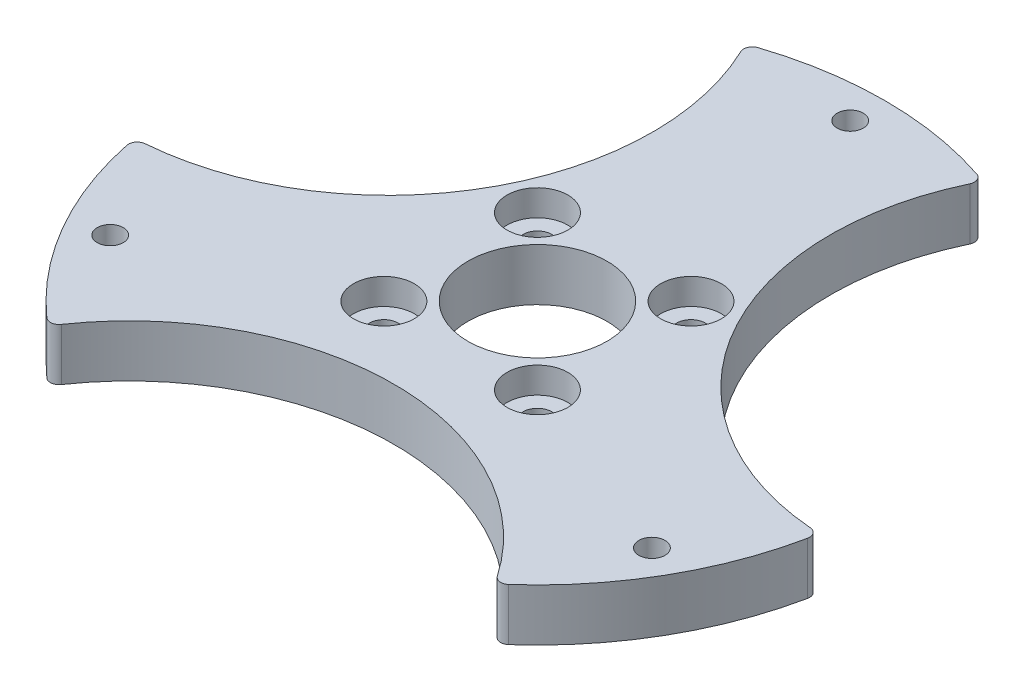
from build123d import *

# Parameters (mm, degrees)
SKETCH1_R           = 40
BOSS_EXTRUDE1_DEPTH = 6
SKETCH3_R           = 30.471270003
CUT_EXTRUDE1_DEPTH  = 57.885850613
SKETCH5_R           = 1.5
CUT_EXTRUDE2_DEPTH  = 57.885850613
CIRPATTERN1_COUNT   = 3
SKETCH6_R           = 1.65
CUT_EXTRUDE3_DEPTH  = 57.460199226
SKETCH7_R           = 8
CUT_EXTRUDE4_DEPTH  = 57.460199226
FILLET1_R           = 1
SKETCH8_R           = 3.5
CUT_EXTRUDE5_DEPTH  = 3


with BuildPart() as part:
    # Sketch1 → Boss-Extrude1 (new body)
    with BuildSketch(Plane(origin=(0, 0, 0), x_dir=(1, 0, 0), z_dir=(0, 1, 0))):
        Circle(SKETCH1_R)
    extrude(amount=BOSS_EXTRUDE1_DEPTH)

    # Sketch3 → Cut-Extrude1 (cut, through all)
    with BuildSketch(Plane(origin=(0, 6, 0), x_dir=(1, 0, 0), z_dir=(0, 1, 0))):
        with Locations((40.698571494, 23.497331208)):
            Circle(SKETCH3_R)
    cut_extrude1 = extrude(amount=-CUT_EXTRUDE1_DEPTH, mode=Mode.SUBTRACT)

    # Sketch5 → Cut-Extrude2 (cut, through all)
    with BuildSketch(Plane(origin=(0, 6, 0), x_dir=(1, 0, 0), z_dir=(0, 1, 0))):
        with Locations((0, 36)):
            Circle(SKETCH5_R)
    cut_extrude2 = extrude(amount=-CUT_EXTRUDE2_DEPTH, mode=Mode.SUBTRACT)

    # CirPattern1: Cut-Extrude1, Cut-Extrude2 ×3 about axis
    cirpattern1_axis = Axis((0, 6, 0), (0, -1, 0))
    add([cut_extrude1.rotate(cirpattern1_axis, i * 360 / CIRPATTERN1_COUNT) for i in range(1, CIRPATTERN1_COUNT)], mode=Mode.SUBTRACT)
    add([cut_extrude2.rotate(cirpattern1_axis, i * 360 / CIRPATTERN1_COUNT) for i in range(1, CIRPATTERN1_COUNT)], mode=Mode.SUBTRACT)

    # Sketch6 → Cut-Extrude3 (cut, through all)
    with BuildSketch(Plane(origin=(0, 6, 0), x_dir=(1, 0, 0), z_dir=(0, 1, 0))):
        with Locations((8.838834765, 8.838834765)):
            Circle(SKETCH6_R)
        with Locations((-8.838834765, 8.838834765)):
            Circle(SKETCH6_R)
        with Locations((-8.838834765, -8.838834765)):
            Circle(SKETCH6_R)
        with Locations((8.838834765, -8.838834765)):
            Circle(SKETCH6_R)
    extrude(amount=-CUT_EXTRUDE3_DEPTH, mode=Mode.SUBTRACT)

    # Sketch7 → Cut-Extrude4 (cut, through all)
    with BuildSketch(Plane(origin=(0, 6, 0), x_dir=(1, 0, 0), z_dir=(0, 1, 0))):
        Circle(SKETCH7_R)
    extrude(amount=-CUT_EXTRUDE4_DEPTH, mode=Mode.SUBTRACT)

    # Fillet1
    fillet1_edges = [part.edges().sort_by_distance(p)[0] for p in [
        (-39.39231012, 3, 6.945927107),
        (-13.680805733, 3, -37.587704831),
        (25.711504387, 3, 30.641777725),
        (-25.711504387, 3, 30.641777725),
        (39.39231012, 3, 6.945927107),
        (13.680805733, 3, -37.587704831),
    ]]
    fillet(fillet1_edges, radius=FILLET1_R)

    # Sketch8 → Cut-Extrude5 (cut)
    with BuildSketch(Plane.XZ.offset(-6)):
        with Locations((8.838834765, 8.838834765)):
            Circle(SKETCH8_R)
        with Locations((8.838834765, -8.838834765)):
            Circle(SKETCH8_R)
        with Locations((-8.838834765, 8.838834765)):
            Circle(SKETCH8_R)
        with Locations((-8.838834765, -8.838834765)):
            Circle(SKETCH8_R)
    extrude(amount=CUT_EXTRUDE5_DEPTH, mode=Mode.SUBTRACT)


solid = part.part
